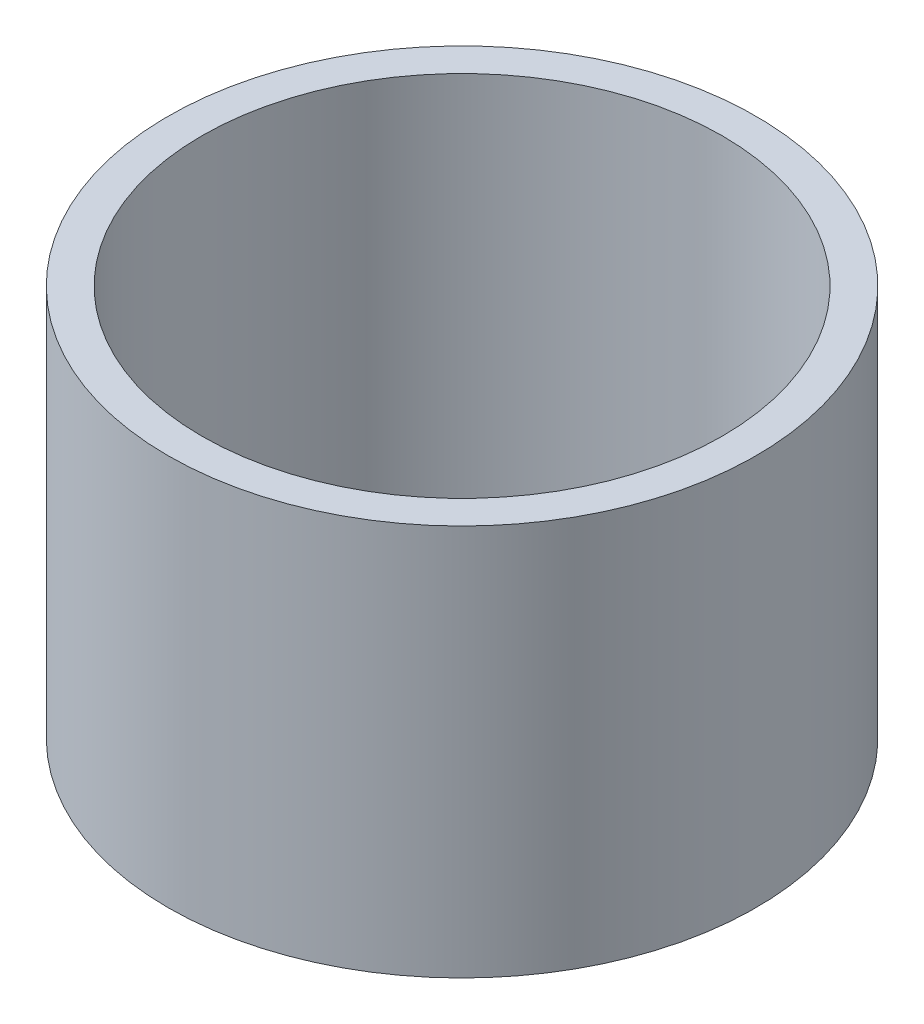
from build123d import *

# Parameters (mm, degrees)
SKETCH1_R           = 57.5
BOSS_EXTRUDE1_DEPTH = 76.55173538
SKETCH2_R           = 50.888055891
CUT_EXTRUDE1_DEPTH  = 112.681100414


with BuildPart() as part:
    # Sketch1 → Boss-Extrude1 (new body)
    with BuildSketch(Plane(origin=(0, 0, 0), x_dir=(1, 0, 0), z_dir=(0, 1, 0))):
        Circle(SKETCH1_R)
    extrude(amount=BOSS_EXTRUDE1_DEPTH)

    # Sketch2 → Cut-Extrude1 (cut, through all)
    with BuildSketch(Plane(origin=(0, 0, 0), x_dir=(1, 0, 0), z_dir=(0, 1, 0))):
        Circle(SKETCH2_R)
    extrude(amount=CUT_EXTRUDE1_DEPTH, mode=Mode.SUBTRACT)


solid = part.part
